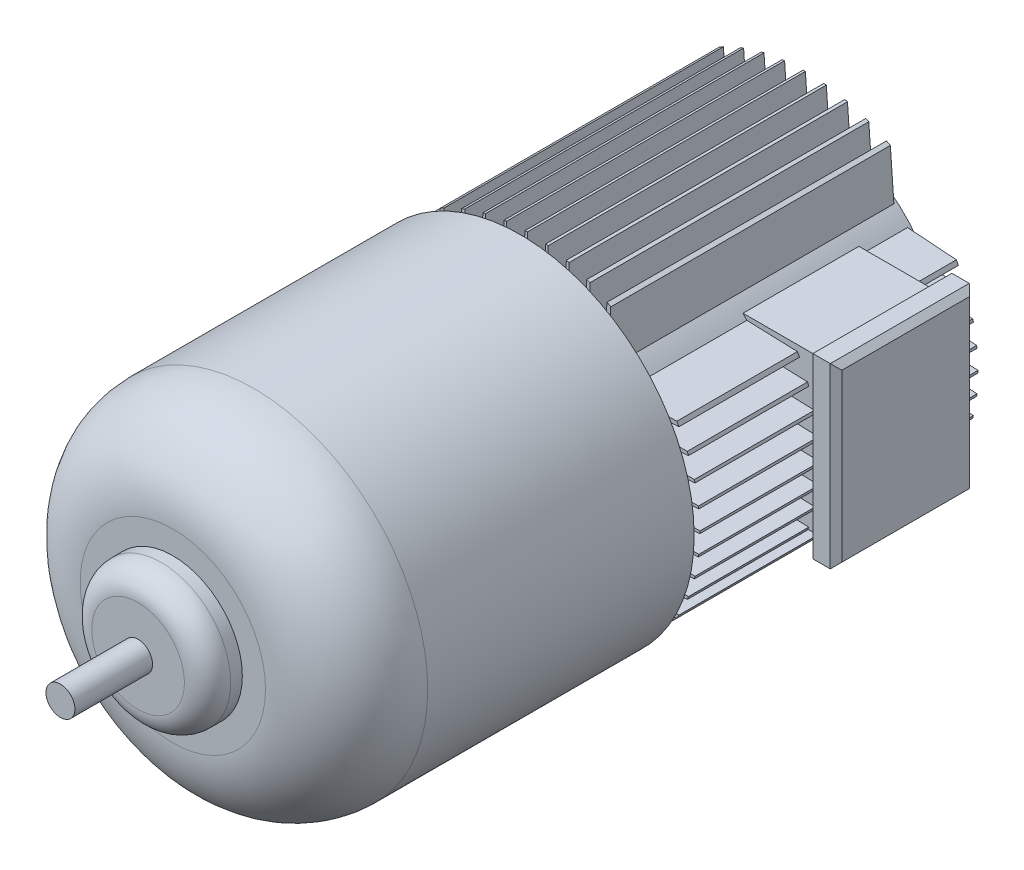
from build123d import *

# Parameters (mm, degrees)
IZIM1_R                         = 150
Y_KSEKLIK_EKSTR_ZYON1_DEPTH     = 300
RADYUS1_R                       = 70
IZIM2_R                         = 60
Y_KSEKLIK_EKSTR_ZYON2_DEPTH     = 30
RADYUS2_R                       = 20
IZIM3_R                         = 115
Y_KSEKLIK_EKSTR_ZYON3_DEPTH     = 250
Y_KSEKLIK_EKSTR_ZYON4_OUTLINE_W = 2
Y_KSEKLIK_EKSTR_ZYON4_OUTLINE_H = 240
Y_KSEKLIK_EKSTR_ZYON4_DEPTH     = 35.021487347
Y_KSEKLIK_EKSTR_ZYON4_TAPER     = -2
L_O_ALTMA1_OUTLINE_W            = 2
L_O_ALTMA1_OUTLINE_H            = 240
L_O_ALTMA1_DEPTH                = 36.803220934
L_O_ALTMA1_TAPER                = -2
L_O_ALTMA1_2_OUTLINE_W          = 2
L_O_ALTMA1_2_OUTLINE_H          = 240
L_O_ALTMA1_2_DEPTH              = 41.619479426
L_O_ALTMA1_2_TAPER              = -2
L_O_ALTMA1_3_OUTLINE_W          = 2
L_O_ALTMA1_3_OUTLINE_H          = 240
L_O_ALTMA1_3_DEPTH              = 49.975073577
L_O_ALTMA1_3_TAPER              = -2
L_O_ALTMA1_4_OUTLINE_W          = 2
L_O_ALTMA1_4_OUTLINE_H          = 240
L_O_ALTMA1_4_DEPTH              = 62.994318789
L_O_ALTMA1_4_TAPER              = -2
L_O_ALTMA1_5_OUTLINE_W          = 2
L_O_ALTMA1_5_OUTLINE_H          = 240
L_O_ALTMA1_5_DEPTH              = 36.803220934
L_O_ALTMA1_5_TAPER              = -2
L_O_ALTMA1_6_OUTLINE_W          = 2
L_O_ALTMA1_6_OUTLINE_H          = 240
L_O_ALTMA1_6_DEPTH              = 41.619479426
L_O_ALTMA1_6_TAPER              = -2
L_O_ALTMA1_7_OUTLINE_W          = 2
L_O_ALTMA1_7_OUTLINE_H          = 240
L_O_ALTMA1_7_DEPTH              = 49.975073577
L_O_ALTMA1_7_TAPER              = -2
L_O_ALTMA1_8_OUTLINE_W          = 2
L_O_ALTMA1_8_OUTLINE_H          = 240
L_O_ALTMA1_8_DEPTH              = 62.994318789
L_O_ALTMA1_8_TAPER              = -2
DAIRESEL_KAPLAMA1_COUNT         = 4
IZIM5_R                         = 191.658172397
IZIM5_R_2                       = 150.003333296
KES_EKSTR_ZYON2_DEPTH           = 250
IZIM6_W                         = 100
IZIM6_H                         = 133.504532572
Y_KSEKLIK_EKSTR_ZYON5_DEPTH     = 154
IZIM8_W                         = 120
IZIM8_H                         = 153.504532572
Y_KSEKLIK_EKSTR_ZYON7_DEPTH     = 20
PAH1_SIZE                       = 5
IZIM12_R                        = 12.5
Y_KSEKLIK_EKSTR_ZYON10_DEPTH    = 67


# Read off the part's stored shape, not the designer's step: Yükseklik-Ekstrüzyon4, LÇoğaltma1
with BuildPart() as part:
    # Çizim1 → Yükseklik-Ekstrüzyon1 (new body)
    with BuildSketch(Plane.XY):
        Circle(IZIM1_R)
    extrude(amount=-Y_KSEKLIK_EKSTR_ZYON1_DEPTH)

    # Radyus1
    radyus1_edges = [part.edges().sort_by_distance(p)[0] for p in [
        (-150, 0, 0),
    ]]
    fillet(radyus1_edges, radius=RADYUS1_R)

    # Çizim2 → Yükseklik-Ekstrüzyon2 (add)
    with BuildSketch(Plane.XY):
        Circle(IZIM2_R)
    extrude(amount=Y_KSEKLIK_EKSTR_ZYON2_DEPTH)

    # Radyus2
    radyus2_edges = [part.edges().sort_by_distance(p)[0] for p in [
        (-60, 0, 30),
    ]]
    fillet(radyus2_edges, radius=RADYUS2_R)

    # Çizim3 → Yükseklik-Ekstrüzyon3 (add)
    with BuildSketch(Plane(origin=(0, 0, -300), x_dir=(-1, 0, 0), z_dir=(0, 0, -1))):
        Circle(IZIM3_R)
    extrude(amount=Y_KSEKLIK_EKSTR_ZYON3_DEPTH)

    # Yükseklik-Ekstrüzyon4 outline → Yükseklik-Ekstrüzyon4 (add)
    with BuildSketch(Plane(origin=(0, 150, 0), x_dir=(1, 0, 0), z_dir=(0, 1, 0))):
        with Locations((0, 425)):
            Rectangle(Y_KSEKLIK_EKSTR_ZYON4_OUTLINE_W, Y_KSEKLIK_EKSTR_ZYON4_OUTLINE_H)
    y_kseklik_ekstr_zyon4 = extrude(amount=-Y_KSEKLIK_EKSTR_ZYON4_DEPTH, taper=Y_KSEKLIK_EKSTR_ZYON4_TAPER)

    # LÇoğaltma1 outline → LÇoğaltma1 (add)
    with BuildSketch(Plane(origin=(0, 150, 0), x_dir=(1, 0, 0), z_dir=(0, 1, 0))):
        with Locations((-18, 425)):
            Rectangle(L_O_ALTMA1_OUTLINE_W, L_O_ALTMA1_OUTLINE_H)
    l_o_altma1 = extrude(amount=-L_O_ALTMA1_DEPTH, taper=L_O_ALTMA1_TAPER)

    # L_o_altma1 2 outline → L_o_altma1 2 (add)
    with BuildSketch(Plane(origin=(0, 150, 0), x_dir=(1, 0, 0), z_dir=(0, 1, 0))):
        with Locations((-36, 425)):
            Rectangle(L_O_ALTMA1_2_OUTLINE_W, L_O_ALTMA1_2_OUTLINE_H)
    l_o_altma1_2 = extrude(amount=-L_O_ALTMA1_2_DEPTH, taper=L_O_ALTMA1_2_TAPER)

    # L_o_altma1 3 outline → L_o_altma1 3 (add)
    with BuildSketch(Plane(origin=(0, 150, 0), x_dir=(1, 0, 0), z_dir=(0, 1, 0))):
        with Locations((-54, 425)):
            Rectangle(L_O_ALTMA1_3_OUTLINE_W, L_O_ALTMA1_3_OUTLINE_H)
    l_o_altma1_3 = extrude(amount=-L_O_ALTMA1_3_DEPTH, taper=L_O_ALTMA1_3_TAPER)

    # L_o_altma1 4 outline → L_o_altma1 4 (add)
    with BuildSketch(Plane(origin=(0, 150, 0), x_dir=(1, 0, 0), z_dir=(0, 1, 0))):
        with Locations((-72, 425)):
            Rectangle(L_O_ALTMA1_4_OUTLINE_W, L_O_ALTMA1_4_OUTLINE_H)
    l_o_altma1_4 = extrude(amount=-L_O_ALTMA1_4_DEPTH, taper=L_O_ALTMA1_4_TAPER)

    # L_o_altma1 5 outline → L_o_altma1 5 (add)
    with BuildSketch(Plane(origin=(0, 150, 0), x_dir=(1, 0, 0), z_dir=(0, 1, 0))):
        with Locations((18, 425)):
            Rectangle(L_O_ALTMA1_5_OUTLINE_W, L_O_ALTMA1_5_OUTLINE_H)
    l_o_altma1_5 = extrude(amount=-L_O_ALTMA1_5_DEPTH, taper=L_O_ALTMA1_5_TAPER)

    # L_o_altma1 6 outline → L_o_altma1 6 (add)
    with BuildSketch(Plane(origin=(0, 150, 0), x_dir=(1, 0, 0), z_dir=(0, 1, 0))):
        with Locations((36, 425)):
            Rectangle(L_O_ALTMA1_6_OUTLINE_W, L_O_ALTMA1_6_OUTLINE_H)
    l_o_altma1_6 = extrude(amount=-L_O_ALTMA1_6_DEPTH, taper=L_O_ALTMA1_6_TAPER)

    # L_o_altma1 7 outline → L_o_altma1 7 (add)
    with BuildSketch(Plane(origin=(0, 150, 0), x_dir=(1, 0, 0), z_dir=(0, 1, 0))):
        with Locations((54, 425)):
            Rectangle(L_O_ALTMA1_7_OUTLINE_W, L_O_ALTMA1_7_OUTLINE_H)
    l_o_altma1_7 = extrude(amount=-L_O_ALTMA1_7_DEPTH, taper=L_O_ALTMA1_7_TAPER)

    # L_o_altma1 8 outline → L_o_altma1 8 (add)
    with BuildSketch(Plane(origin=(0, 150, 0), x_dir=(1, 0, 0), z_dir=(0, 1, 0))):
        with Locations((72, 425)):
            Rectangle(L_O_ALTMA1_8_OUTLINE_W, L_O_ALTMA1_8_OUTLINE_H)
    l_o_altma1_8 = extrude(amount=-L_O_ALTMA1_8_DEPTH, taper=L_O_ALTMA1_8_TAPER)

    # Dairesel Kaplama1: Yükseklik-Ekstrüzyon4, LÇoğaltma1, L_o_altma1 2, L_o_altma1 3, L_o_altma1 4, L_o_altma1 5, L_o_altma1 6, L_o_altma1 7, L_o_altma1 8 ×4 about axis
    dairesel_kaplama1_axis = Axis((0, 0, -550), (0, 0, 1))
    add([y_kseklik_ekstr_zyon4.rotate(dairesel_kaplama1_axis, i * 360 / DAIRESEL_KAPLAMA1_COUNT) for i in range(1, DAIRESEL_KAPLAMA1_COUNT)])
    add([l_o_altma1.rotate(dairesel_kaplama1_axis, i * 360 / DAIRESEL_KAPLAMA1_COUNT) for i in range(1, DAIRESEL_KAPLAMA1_COUNT)])
    add([l_o_altma1_2.rotate(dairesel_kaplama1_axis, i * 360 / DAIRESEL_KAPLAMA1_COUNT) for i in range(1, DAIRESEL_KAPLAMA1_COUNT)])
    add([l_o_altma1_3.rotate(dairesel_kaplama1_axis, i * 360 / DAIRESEL_KAPLAMA1_COUNT) for i in range(1, DAIRESEL_KAPLAMA1_COUNT)])
    add([l_o_altma1_4.rotate(dairesel_kaplama1_axis, i * 360 / DAIRESEL_KAPLAMA1_COUNT) for i in range(1, DAIRESEL_KAPLAMA1_COUNT)])
    add([l_o_altma1_5.rotate(dairesel_kaplama1_axis, i * 360 / DAIRESEL_KAPLAMA1_COUNT) for i in range(1, DAIRESEL_KAPLAMA1_COUNT)])
    add([l_o_altma1_6.rotate(dairesel_kaplama1_axis, i * 360 / DAIRESEL_KAPLAMA1_COUNT) for i in range(1, DAIRESEL_KAPLAMA1_COUNT)])
    add([l_o_altma1_7.rotate(dairesel_kaplama1_axis, i * 360 / DAIRESEL_KAPLAMA1_COUNT) for i in range(1, DAIRESEL_KAPLAMA1_COUNT)])
    add([l_o_altma1_8.rotate(dairesel_kaplama1_axis, i * 360 / DAIRESEL_KAPLAMA1_COUNT) for i in range(1, DAIRESEL_KAPLAMA1_COUNT)])

    # Çizim5 → Kes-Ekstrüzyon2 (cut)
    with BuildSketch(Plane(origin=(0, 0, -550), x_dir=(-1, 0, 0), z_dir=(0, 0, -1))):
        Circle(IZIM5_R)
        Circle(IZIM5_R_2, mode=Mode.SUBTRACT)
    extrude(amount=-KES_EKSTR_ZYON2_DEPTH, mode=Mode.SUBTRACT)

    # Çizim6 → Yükseklik-Ekstrüzyon5 (add)
    with BuildSketch(Plane(origin=(0, 0, 0), x_dir=(0, 0, -1), z_dir=(1, 0, 0))):
        with Locations((458.465717737, 12.110062496)):
            Rectangle(IZIM6_W, IZIM6_H)
    extrude(amount=Y_KSEKLIK_EKSTR_ZYON5_DEPTH)

    # Çizim8 → Yükseklik-Ekstrüzyon7 (add)
    with BuildSketch(Plane(origin=(154, 0, 0), x_dir=(0, 0, -1), z_dir=(1, 0, 0))):
        with Locations((458.465717737, 12.110062496)):
            Rectangle(IZIM8_W, IZIM8_H)
    extrude(amount=Y_KSEKLIK_EKSTR_ZYON7_DEPTH)

    # Pah1
    pah1_edges = [part.edges().sort_by_distance(p)[0] for p in [
        (174, 88.862328782, -458.465717737),
        (174, 12.110062496, -398.465717737),
        (174, -64.64220379, -458.465717737),
        (174, 12.110062496, -518.465717737),
    ]]
    chamfer(pah1_edges, length=PAH1_SIZE)

    # Çizim12 → Yükseklik-Ekstrüzyon10 (add)
    with BuildSketch(Plane.XY.offset(30)):
        Circle(IZIM12_R)
    extrude(amount=Y_KSEKLIK_EKSTR_ZYON10_DEPTH)


solid = part.part
